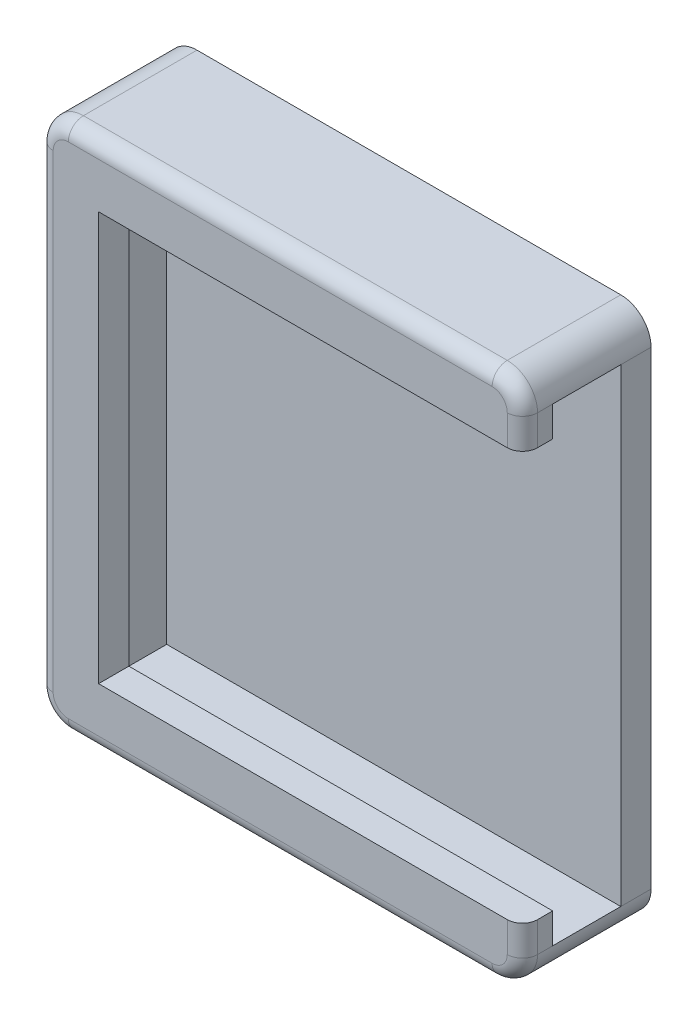
from build123d import *

# Parameters (mm, degrees)
SKETCH1_W           = 32
SKETCH1_H           = 35
BOSS_EXTRUDE1_DEPTH = 2
BOSS_EXTRUDE2_DEPTH = 4.5
BOSS_EXTRUDE3_DEPTH = 2
FILLET1_START       = -1
FILLET1_DEPTH       = 10
FILLET2_R           = 1


with BuildPart() as part:
    # Sketch1 → Boss-Extrude1 (new body)
    with BuildSketch(Plane.XY):
        with Locations((-173.423957437, 24.831611866)):
            Rectangle(SKETCH1_W, SKETCH1_H)
    extrude(amount=BOSS_EXTRUDE1_DEPTH)

    # Sketch2 → Boss-Extrude2 (add)
    with BuildSketch(Plane.XY.offset(2)):
        Polygon((-157.423957437, 42.331611866), (-189.423957437, 42.331611866), (-189.423957437, 7.331611866), (-157.423957437, 7.331611866), (-157.423957437, 9.331611866), (-187.423957437, 9.331611866), (-187.423957437, 40.331611866), (-157.423957437, 40.331611866), align=None)
    extrude(amount=BOSS_EXTRUDE2_DEPTH)

    # Sketch3 → Boss-Extrude3 (add)
    with BuildSketch(Plane.XY.offset(6.5)):
        Polygon((-157.423957437, 42.331611866), (-189.423957437, 42.331611866), (-189.423957437, 7.331611866), (-157.423957437, 7.331611866), (-157.423957437, 11.331611866), (-185.423957437, 11.331611866), (-185.423957437, 38.331611866), (-157.423957437, 38.331611866), align=None)
    extrude(amount=BOSS_EXTRUDE3_DEPTH)

    # Fillet1: read off the stored shape, not the designer's step
    # Fillet1 outline → Fillet1 (cut)
    with BuildSketch(Plane.XY.offset(FILLET1_START)):
        with BuildLine():
            Line((-157.423957437, 42.331611866), (-159.423957437, 42.331611866))
            ThreePointArc((-159.423957437, 42.331611866), (-158.009743875, 41.745825428), (-157.423957437, 40.331611866))
            Line((-157.423957437, 40.331611866), (-157.423957437, 42.331611866))
        make_face()
        with BuildLine():
            ThreePointArc((-189.423957437, 40.331611866), (-188.838170999, 41.745825428), (-187.423957437, 42.331611866))
            Line((-187.423957437, 42.331611866), (-189.423957437, 42.331611866))
            Line((-189.423957437, 42.331611866), (-189.423957437, 40.331611866))
        make_face()
        with BuildLine():
            ThreePointArc((-187.423957437, 7.331611866), (-188.838170999, 7.917398304), (-189.423957437, 9.331611866))
            Line((-189.423957437, 9.331611866), (-189.423957437, 7.331611866))
            Line((-189.423957437, 7.331611866), (-187.423957437, 7.331611866))
        make_face()
        with BuildLine():
            Line((-157.423957437, 7.331611866), (-157.423957437, 9.331611866))
            ThreePointArc((-157.423957437, 9.331611866), (-158.009743875, 7.917398303), (-159.423957437, 7.331611866))
            Line((-159.423957437, 7.331611866), (-157.423957437, 7.331611866))
        make_face()
    extrude(amount=FILLET1_DEPTH, mode=Mode.SUBTRACT)

    # Fillet2
    fillet2_edges = [part.edges().sort_by_distance(p)[0] for p in [
        (-157.423957437, 10.331611866, 8.5),
        (-158.009743875, 41.745825428, 8.5),
        (-173.423957437, 42.331611866, 8.5),
        (-188.838170999, 41.745825428, 8.5),
        (-158.009743875, 7.917398303, 8.5),
        (-173.423957437, 7.331611866, 8.5),
        (-188.838170999, 7.917398304, 8.5),
        (-189.423957437, 24.831611866, 8.5),
    ]]
    fillet(fillet2_edges, radius=FILLET2_R)


solid = part.part
